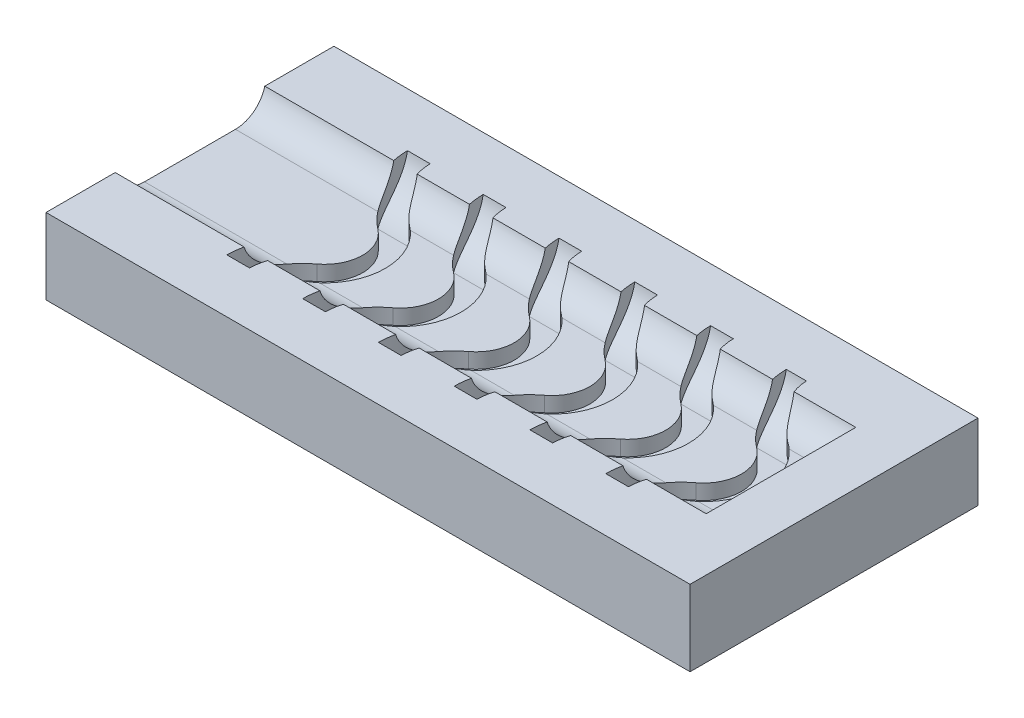
from build123d import *

# Parameters (mm, degrees)
SKETCH1_W            = 56
SKETCH1_H            = 24
BOSS_EXTRUDE1_DEPTH  = 10
SKETCH2_W            = 70
SKETCH2_H            = 38
BOSS_EXTRUDE2_DEPTH  = 7
CUT_EXTRUDE8_DEPTH   = 2
CUT_EXTRUDE10_DEPTH  = 2
CUT_EXTRUDE11_DEPTH  = 2
CUT_EXTRUDE12_DEPTH  = 2
CUT_EXTRUDE13_DEPTH  = 2
CUT_EXTRUDE14_DEPTH  = 2
SKETCH9_W            = 2.87264454
SKETCH9_H            = 24
CUT_EXTRUDE15_DEPTH  = 5
SKETCH10_W           = 24
SKETCH10_H           = 5
CUT_EXTRUDE16_DEPTH  = 18
BOSS_EXTRUDE3_START  = 3
BOSS_EXTRUDE3_DEPTH  = 3
BOSS_EXTRUDE4_DEPTH  = 149
CUT_EXTRUDE17_REACH  = 156.199
SKETCH14_R           = 4
SKETCH15_W           = 38
SKETCH15_H           = 5.821798295
CUT_EXTRUDE18_DEPTH  = 103
SKETCH16_W           = 38
SKETCH16_H           = 10
BOSS_EXTRUDE5_DEPTH  = 7
SKETCH17_W           = 5.389872087
SKETCH17_H           = 2
CUT_EXTRUDE19_DEPTH  = 12
CUT_EXTRUDE20_DEPTH  = 2
BOSS_EXTRUDE6_DEPTH  = 15
BOSS_EXTRUDE8_START  = -2
SKETCH22_W           = 25.766665867
SKETCH22_H           = 23.832159567
BOSS_EXTRUDE8_DEPTH  = 5
CUT_EXTRUDE21_DEPTH  = 5
BOSS_EXTRUDE9_START  = 3
BOSS_EXTRUDE9_DEPTH  = 3
BOSS_EXTRUDE10_DEPTH = 5
CUT_EXTRUDE22_DEPTH  = 5
CUT_EXTRUDE23_START  = -49
CUT_EXTRUDE23_DEPTH  = 49
BOSS_EXTRUDE11_START = -120
BOSS_EXTRUDE11_DEPTH = 120
CUT_EXTRUDE25_START  = -43
CUT_EXTRUDE25_DEPTH  = 43
CUT_EXTRUDE27_START  = -15
CUT_EXTRUDE27_DEPTH  = 15
CUT_EXTRUDE28_DEPTH  = 20


with BuildPart() as part:
    # Sketch1 → Boss-Extrude1 (new body)
    with BuildSketch(Plane(origin=(0, 0, 0), x_dir=(1, 0, 0), z_dir=(0, 1, 0))):
        Polygon((-71.036942105, -38.149752846), (-8.036942105, -38.149752846), (-1.036942105, -38.149752846), (-1.036942105, -0.149752846), (-71.036942105, -0.149752846), align=None)
        with Locations((-36.036942105, -19.149752846)):
            Rectangle(SKETCH1_W, SKETCH1_H, mode=Mode.SUBTRACT)
    extrude(amount=BOSS_EXTRUDE1_DEPTH)

    # Sketch2 → Boss-Extrude2 (add)
    with BuildSketch(Plane.XZ):
        with Locations((-36.036942105, 19.149752846)):
            Rectangle(SKETCH2_W, SKETCH2_H)
    extrude(amount=-BOSS_EXTRUDE2_DEPTH)

    # Sketch3 → Cut-Extrude8 (cut)
    with BuildSketch(Plane(origin=(0, 7, 0), x_dir=(1, 0, 0), z_dir=(0, 1, 0))):
        with BuildLine():
            Line((-19.24851185, -31.149752846), (-16.24851185, -31.149752846))
            ThreePointArc((-16.24851185, -31.149752846), (-15.509502185, -28.019257672), (-13.448511841, -25.549752839))
            ThreePointArc((-13.448511841, -25.549752839), (-10.249398009, -19.030682482), (-13.641129982, -12.609719793))
            ThreePointArc((-13.641129982, -12.609719793), (-15.761818316, -10.226514402), (-16.604744928, -7.149752846))
            Line((-16.604744928, -7.149752846), (-19.24851185, -7.149752846))
            ThreePointArc((-19.24851185, -7.149752846), (-18.192783772, -11.621888777), (-15.248511893, -15.149752813))
            ThreePointArc((-15.248511893, -15.149752813), (-13.24851185, -19.14975286), (-15.248511915, -23.149752894))
            ThreePointArc((-15.248511915, -23.149752894), (-18.192783778, -26.677616927), (-19.24851185, -31.149752846))
        make_face()
    extrude(amount=-CUT_EXTRUDE8_DEPTH, mode=Mode.SUBTRACT)

    # Sketch4 → Cut-Extrude10 (cut)
    with BuildSketch(Plane(origin=(0, 7, 0), x_dir=(1, 0, 0), z_dir=(0, 1, 0))):
        with BuildLine():
            ThreePointArc((-25.248511794, -15.149752887), (-23.24851185, -19.149752907), (-25.248511893, -23.149752878))
            ThreePointArc((-25.248511893, -23.149752878), (-28.192783772, -26.677616914), (-29.24851185, -31.149752846))
            Line((-29.24851185, -31.149752846), (-26.24851185, -31.149752846))
            ThreePointArc((-26.24851185, -31.149752846), (-25.509502185, -28.019257672), (-23.448511841, -25.549752839))
            ThreePointArc((-23.448511841, -25.549752839), (-20.24851185, -19.149752846), (-23.448511841, -12.749752852))
            ThreePointArc((-23.448511841, -12.749752852), (-25.509502185, -10.280248019), (-26.24851185, -7.149752846))
            Line((-26.24851185, -7.149752846), (-29.24851185, -7.149752846))
            ThreePointArc((-29.24851185, -7.149752846), (-28.192783745, -11.621888832), (-25.248511794, -15.149752887))
        make_face()
    extrude(amount=-CUT_EXTRUDE10_DEPTH, mode=Mode.SUBTRACT)

    # Sketch5 → Cut-Extrude11 (cut)
    with BuildSketch(Plane(origin=(0, 7, 0), x_dir=(1, 0, 0), z_dir=(0, 1, 0))):
        with BuildLine():
            ThreePointArc((-35.248511724, -15.14975294), (-33.24851185, -19.149752846), (-35.248511724, -23.149752751))
            ThreePointArc((-35.248511724, -23.149752751), (-38.192783725, -26.67761682), (-39.24851185, -31.149752846))
            Line((-39.24851185, -31.149752846), (-36.24851185, -31.149752846))
            ThreePointArc((-36.24851185, -31.149752846), (-35.509502185, -28.019257672), (-33.448511841, -25.549752839))
            ThreePointArc((-33.448511841, -25.549752839), (-30.24851185, -19.149752771), (-33.44851196, -12.749752763))
            ThreePointArc((-33.44851196, -12.749752763), (-35.509502218, -10.280247952), (-36.24851185, -7.149752846))
            Line((-36.24851185, -7.149752846), (-39.24851185, -7.149752846))
            ThreePointArc((-39.24851185, -7.149752846), (-38.192783725, -11.621888871), (-35.248511724, -15.14975294))
        make_face()
    extrude(amount=-CUT_EXTRUDE11_DEPTH, mode=Mode.SUBTRACT)

    # Sketch6 → Cut-Extrude12 (cut)
    with BuildSketch(Plane(origin=(0, 7, 0), x_dir=(1, 0, 0), z_dir=(0, 1, 0))):
        with BuildLine():
            ThreePointArc((-45.24851166, -15.149752988), (-43.24851185, -19.149752991), (-45.248511893, -23.149752878))
            ThreePointArc((-45.248511893, -23.149752878), (-48.192783772, -26.677616914), (-49.24851185, -31.149752846))
            Line((-49.24851185, -31.149752846), (-46.24851185, -31.149752846))
            ThreePointArc((-46.24851185, -31.149752846), (-45.509502185, -28.019257672), (-43.448511841, -25.549752839))
            ThreePointArc((-43.448511841, -25.549752839), (-40.24851185, -19.149752888), (-43.448511772, -12.749752904))
            ThreePointArc((-43.448511772, -12.749752904), (-45.509502165, -10.280248057), (-46.24851185, -7.149752846))
            Line((-46.24851185, -7.149752846), (-49.24851185, -7.149752846))
            ThreePointArc((-49.24851185, -7.149752846), (-48.192783707, -11.621888907), (-45.24851166, -15.149752988))
        make_face()
    extrude(amount=-CUT_EXTRUDE12_DEPTH, mode=Mode.SUBTRACT)

    # Sketch7 → Cut-Extrude13 (cut)
    with BuildSketch(Plane(origin=(0, 7, 0), x_dir=(1, 0, 0), z_dir=(0, 1, 0))):
        with BuildLine():
            ThreePointArc((-55.248511853, -15.149752843), (-53.24851185, -19.149752765), (-55.248511724, -23.149752751))
            ThreePointArc((-55.248511724, -23.149752751), (-58.192783725, -26.67761682), (-59.24851185, -31.149752846))
            Line((-59.24851185, -31.149752846), (-56.24851185, -31.149752846))
            ThreePointArc((-56.24851185, -31.149752846), (-55.509502185, -28.019257672), (-53.448511841, -25.549752839))
            ThreePointArc((-53.448511841, -25.549752839), (-50.24851185, -19.149752914), (-53.448511731, -12.749752935))
            ThreePointArc((-53.448511731, -12.749752935), (-55.509502154, -10.280248081), (-56.24851185, -7.149752846))
            Line((-56.24851185, -7.149752846), (-59.24851185, -7.149752846))
            ThreePointArc((-59.24851185, -7.149752846), (-58.192783761, -11.621888799), (-55.248511853, -15.149752843))
        make_face()
    extrude(amount=-CUT_EXTRUDE13_DEPTH, mode=Mode.SUBTRACT)

    # Sketch8 → Cut-Extrude14 (cut)
    with BuildSketch(Plane(origin=(0, 7, 0), x_dir=(1, 0, 0), z_dir=(0, 1, 0))):
        with BuildLine():
            ThreePointArc((-64.036942105, -25.951420309), (-61.259500548, -23.042530905), (-60.24851185, -19.149752846))
            Line((-60.24851185, -19.149752846), (-63.24851185, -19.149752846))
            ThreePointArc((-63.24851185, -19.149752846), (-63.449665701, -20.553702858), (-64.036942105, -21.844688889))
            Line((-64.036942105, -21.844688889), (-64.036942105, -25.951420309))
        make_face()
        with BuildLine():
            Line((-63.24851185, -19.149752846), (-60.24851185, -19.149752846))
            ThreePointArc((-60.24851185, -19.149752846), (-61.259500548, -15.256974786), (-64.036942105, -12.348085382))
            Line((-64.036942105, -12.348085382), (-64.036942105, -16.454816802))
            ThreePointArc((-64.036942105, -16.454816802), (-63.449665701, -17.745802833), (-63.24851185, -19.149752846))
        make_face()
        with BuildLine():
            ThreePointArc((-64.036942105, -25.951420309), (-61.259500548, -23.042530905), (-60.24851185, -19.149752846))
            Line((-60.24851185, -19.149752846), (-63.24851185, -19.149752846))
            ThreePointArc((-63.24851185, -19.149752846), (-63.449665701, -20.553702858), (-64.036942105, -21.844688889))
            Line((-64.036942105, -21.844688889), (-64.036942105, -25.951420309))
        make_face()
        with BuildLine():
            Line((-63.24851185, -19.149752846), (-60.24851185, -19.149752846))
            ThreePointArc((-60.24851185, -19.149752846), (-61.259500548, -15.256974786), (-64.036942105, -12.348085382))
            Line((-64.036942105, -12.348085382), (-64.036942105, -16.454816802))
            ThreePointArc((-64.036942105, -16.454816802), (-63.449665701, -17.745802833), (-63.24851185, -19.149752846))
        make_face()
    extrude(amount=-CUT_EXTRUDE14_DEPTH, mode=Mode.SUBTRACT)

    # Sketch9 → Cut-Extrude15 (cut)
    with BuildSketch(Plane(origin=(0, 10, 0), x_dir=(1, 0, 0), z_dir=(0, 1, 0))):
        with Locations((-6.600619835, -19.149752846)):
            Rectangle(SKETCH9_W, SKETCH9_H)
    extrude(amount=-CUT_EXTRUDE15_DEPTH, mode=Mode.SUBTRACT)

    # Sketch10 → Cut-Extrude16 (cut)
    with BuildSketch(Plane.ZY.offset(5.164297565)):
        with Locations((19.149752846, 7.5)):
            Rectangle(SKETCH10_W, SKETCH10_H)
    extrude(amount=-CUT_EXTRUDE16_DEPTH, mode=Mode.SUBTRACT)

    # Sketch12 → Boss-Extrude3 (add)
    with BuildSketch(Plane(origin=(0, 7, 0), x_dir=(1, 0, 0), z_dir=(0, 1, 0)).offset(BOSS_EXTRUDE3_START)):
        with BuildLine():
            Line((-16.24851185, -31.149752846), (-8.036942105, -31.149752846))
            Line((-8.036942105, -31.149752846), (-8.036942105, -7.149752846))
            Line((-8.036942105, -7.149752846), (-16.604744928, -7.149752846))
            ThreePointArc((-16.604744928, -7.149752846), (-15.761818318, -10.226514398), (-13.641129989, -12.609719789))
            ThreePointArc((-13.641129989, -12.609719789), (-10.249398009, -19.030682483), (-13.44851185, -25.549752846))
            ThreePointArc((-13.44851185, -25.549752846), (-15.509502187, -28.019257677), (-16.24851185, -31.149752846))
        make_face()
        with BuildLine():
            Line((-26.24851185, -31.149752846), (-19.24851185, -31.149752846))
            ThreePointArc((-19.24851185, -31.149752846), (-18.19278376, -26.677616891), (-15.24851185, -23.149752846))
            ThreePointArc((-15.24851185, -23.149752846), (-13.24851185, -19.149752846), (-15.24851185, -15.149752846))
            ThreePointArc((-15.24851185, -15.149752846), (-18.19278376, -11.621888801), (-19.24851185, -7.149752846))
            Line((-19.24851185, -7.149752846), (-26.24851185, -7.149752846))
            ThreePointArc((-26.24851185, -7.149752846), (-25.509502187, -10.280248014), (-23.44851185, -12.749752846))
            ThreePointArc((-23.44851185, -12.749752846), (-20.24851185, -19.149752846), (-23.44851185, -25.549752846))
            ThreePointArc((-23.44851185, -25.549752846), (-25.509502187, -28.019257677), (-26.24851185, -31.149752846))
        make_face()
        with BuildLine():
            Line((-36.24851185, -31.149752846), (-29.24851185, -31.149752846))
            ThreePointArc((-29.24851185, -31.149752846), (-28.19278376, -26.677616891), (-25.24851185, -23.149752846))
            ThreePointArc((-25.24851185, -23.149752846), (-23.24851185, -19.149752846), (-25.24851185, -15.149752846))
            ThreePointArc((-25.24851185, -15.149752846), (-28.19278376, -11.621888801), (-29.24851185, -7.149752846))
            Line((-29.24851185, -7.149752846), (-36.24851185, -7.149752846))
            ThreePointArc((-36.24851185, -7.149752846), (-35.509502187, -10.280248014), (-33.44851185, -12.749752846))
            ThreePointArc((-33.44851185, -12.749752846), (-30.24851185, -19.149752846), (-33.44851185, -25.549752846))
            ThreePointArc((-33.44851185, -25.549752846), (-35.509502187, -28.019257677), (-36.24851185, -31.149752846))
        make_face()
        with BuildLine():
            Line((-46.24851185, -31.149752846), (-39.24851185, -31.149752846))
            ThreePointArc((-39.24851185, -31.149752846), (-38.19278376, -26.677616891), (-35.24851185, -23.149752846))
            ThreePointArc((-35.24851185, -23.149752846), (-33.24851185, -19.149752846), (-35.24851185, -15.149752846))
            ThreePointArc((-35.24851185, -15.149752846), (-38.19278376, -11.621888801), (-39.24851185, -7.149752846))
            Line((-39.24851185, -7.149752846), (-46.24851185, -7.149752846))
            ThreePointArc((-46.24851185, -7.149752846), (-45.509502187, -10.280248014), (-43.44851185, -12.749752846))
            ThreePointArc((-43.44851185, -12.749752846), (-40.24851185, -19.149752846), (-43.44851185, -25.549752846))
            ThreePointArc((-43.44851185, -25.549752846), (-45.509502187, -28.019257677), (-46.24851185, -31.149752846))
        make_face()
        with BuildLine():
            Line((-56.24851185, -31.149752846), (-49.24851185, -31.149752846))
            ThreePointArc((-49.24851185, -31.149752846), (-48.19278376, -26.677616891), (-45.24851185, -23.149752846))
            ThreePointArc((-45.24851185, -23.149752846), (-43.24851185, -19.149752846), (-45.24851185, -15.149752846))
            ThreePointArc((-45.24851185, -15.149752846), (-48.19278376, -11.621888801), (-49.24851185, -7.149752846))
            Line((-49.24851185, -7.149752846), (-56.24851185, -7.149752846))
            ThreePointArc((-56.24851185, -7.149752846), (-55.509502187, -10.280248014), (-53.44851185, -12.749752846))
            ThreePointArc((-53.44851185, -12.749752846), (-50.24851185, -19.149752846), (-53.44851185, -25.549752846))
            ThreePointArc((-53.44851185, -25.549752846), (-55.509502187, -28.019257677), (-56.24851185, -31.149752846))
        make_face()
        with BuildLine():
            Line((-64.036942105, -7.149752846), (-64.036942105, -12.348085382))
            ThreePointArc((-64.036942105, -12.348085382), (-60.24851185, -19.149752846), (-64.036942105, -25.951420309))
            Line((-64.036942105, -25.951420309), (-64.036942105, -31.149752846))
            Line((-64.036942105, -31.149752846), (-59.24851185, -31.149752846))
            ThreePointArc((-59.24851185, -31.149752846), (-58.19278376, -26.677616891), (-55.24851185, -23.149752846))
            ThreePointArc((-55.24851185, -23.149752846), (-53.24851185, -19.149752846), (-55.24851185, -15.149752846))
            ThreePointArc((-55.24851185, -15.149752846), (-58.19278376, -11.621888801), (-59.24851185, -7.149752846))
            Line((-59.24851185, -7.149752846), (-64.036942105, -7.149752846))
        make_face()
        with BuildLine():
            Line((-64.036942105, -16.454816802), (-64.036942105, -21.844688889))
            ThreePointArc((-64.036942105, -21.844688889), (-63.24851185, -19.149752846), (-64.036942105, -16.454816802))
        make_face()
    extrude(amount=-BOSS_EXTRUDE3_DEPTH)

    # Sketch13 → Boss-Extrude4 (add)
    with BuildSketch(Plane(origin=(-1.036942105, 0, 0), x_dir=(0, 0, -1), z_dir=(1, 0, 0))):
        with BuildLine():
            Line((-31.149752846, 10), (-31.149752846, 5))
            Line((-31.149752846, 5), (-25.149752846, 5))
            ThreePointArc((-25.149752846, 5), (-29.392393533, 6.757359313), (-31.149752846, 11))
            Line((-31.149752846, 11), (-31.149752846, 10))
        make_face()
        with BuildLine():
            ThreePointArc((-7.149752846, 11), (-8.907112158, 6.757359313), (-13.149752846, 5))
            Line((-13.149752846, 5), (-7.149752846, 5))
            Line((-7.149752846, 5), (-7.149752846, 10))
            Line((-7.149752846, 10), (-7.149752846, 11))
        make_face()
    extrude(amount=-BOSS_EXTRUDE4_DEPTH)

    # Cut-Extrude17: up to this face of the body (flat: up to its plane)
    cut_extrude17_end = Plane(part.part.faces().sort_by_distance((-64.036942105, 7.501737064, 23.896758638))[0])
    # Sketch14 → Cut-Extrude17 (cut, up to the picked face)
    with BuildSketch(Plane(origin=(-1.036942105, 0, 0), x_dir=(0, 0, -1), z_dir=(1, 0, 0)), mode=Mode.PRIVATE) as cut_extrude17_sk1:
        with Locations((-25.149752846, 11)):
            Circle(SKETCH14_R)
    cut_extrude17_tool1 = split(extrude(cut_extrude17_sk1.sketch, amount=-CUT_EXTRUDE17_REACH, mode=Mode.PRIVATE), bisect_by=cut_extrude17_end, keep=Keep.BOTH, mode=Mode.PRIVATE)
    # Sketch14 → Cut-Extrude17 (cut, up to the picked face)
    with BuildSketch(Plane(origin=(-1.036942105, 0, 0), x_dir=(0, 0, -1), z_dir=(1, 0, 0)), mode=Mode.PRIVATE) as cut_extrude17_sk2:
        with BuildLine():
            ThreePointArc((-13.149752846, 15), (-17.149752846, 11), (-13.149752846, 7))
            Line((-13.149752846, 7), (-13.149752846, 15))
        make_face()
    cut_extrude17_tool2 = split(extrude(cut_extrude17_sk2.sketch, amount=-CUT_EXTRUDE17_REACH, mode=Mode.PRIVATE), bisect_by=cut_extrude17_end, keep=Keep.BOTH, mode=Mode.PRIVATE)
    # Sketch14 → Cut-Extrude17 (cut, up to the picked face)
    with BuildSketch(Plane(origin=(-1.036942105, 0, 0), x_dir=(0, 0, -1), z_dir=(1, 0, 0)), mode=Mode.PRIVATE) as cut_extrude17_sk3:
        with BuildLine():
            Line((-13.149752846, 15), (-13.149752846, 7))
            ThreePointArc((-13.149752846, 7), (-10.321325721, 8.171572875), (-9.149752846, 11))
            ThreePointArc((-9.149752846, 11), (-10.321325721, 13.828427125), (-13.149752846, 15))
        make_face()
    cut_extrude17_tool3 = split(extrude(cut_extrude17_sk3.sketch, amount=-CUT_EXTRUDE17_REACH, mode=Mode.PRIVATE), bisect_by=cut_extrude17_end, keep=Keep.BOTH, mode=Mode.PRIVATE)
    # Sketch14 → Cut-Extrude17 (cut, up to the picked face)
    with BuildSketch(Plane(origin=(-1.036942105, 0, 0), x_dir=(0, 0, -1), z_dir=(1, 0, 0)), mode=Mode.PRIVATE) as cut_extrude17_sk4:
        with BuildLine():
            ThreePointArc((-13.149752846, 15), (-17.149752846, 11), (-13.149752846, 7))
            Line((-13.149752846, 7), (-13.149752846, 15))
        make_face()
    cut_extrude17_tool4 = split(extrude(cut_extrude17_sk4.sketch, amount=-CUT_EXTRUDE17_REACH, mode=Mode.PRIVATE), bisect_by=cut_extrude17_end, keep=Keep.BOTH, mode=Mode.PRIVATE)
    # Sketch14 → Cut-Extrude17 (cut, up to the picked face)
    with BuildSketch(Plane(origin=(-1.036942105, 0, 0), x_dir=(0, 0, -1), z_dir=(1, 0, 0)), mode=Mode.PRIVATE) as cut_extrude17_sk5:
        with BuildLine():
            Line((-13.149752846, 15), (-13.149752846, 7))
            ThreePointArc((-13.149752846, 7), (-10.321325721, 8.171572875), (-9.149752846, 11))
            ThreePointArc((-9.149752846, 11), (-10.321325721, 13.828427125), (-13.149752846, 15))
        make_face()
    cut_extrude17_tool5 = split(extrude(cut_extrude17_sk5.sketch, amount=-CUT_EXTRUDE17_REACH, mode=Mode.PRIVATE), bisect_by=cut_extrude17_end, keep=Keep.BOTH, mode=Mode.PRIVATE)
    # Sketch14 → Cut-Extrude17 (cut, up to the picked face)
    with BuildSketch(Plane(origin=(-1.036942105, 0, 0), x_dir=(0, 0, -1), z_dir=(1, 0, 0)), mode=Mode.PRIVATE) as cut_extrude17_sk6:
        with BuildLine():
            ThreePointArc((-21.149752846, 11), (-22.321325721, 8.171572875), (-25.149752846, 7))
            Line((-25.149752846, 7), (-13.149752846, 7))
            ThreePointArc((-13.149752846, 7), (-17.149752846, 11), (-13.149752846, 15))
            Line((-13.149752846, 15), (-25.149752846, 15))
            ThreePointArc((-25.149752846, 15), (-22.321325721, 13.828427125), (-21.149752846, 11))
        make_face()
    cut_extrude17_tool6 = split(extrude(cut_extrude17_sk6.sketch, amount=-CUT_EXTRUDE17_REACH, mode=Mode.PRIVATE), bisect_by=cut_extrude17_end, keep=Keep.BOTH, mode=Mode.PRIVATE)
    add(cut_extrude17_tool1.solids().sort_by(Axis((-1.036942, 11, 25.149753), (-1, 0, 0)))[0], mode=Mode.SUBTRACT)
    add(cut_extrude17_tool2.solids().sort_by(Axis((-1.036942, 11, 14.847406), (-1, 0, 0)))[0], mode=Mode.SUBTRACT)
    add(cut_extrude17_tool3.solids().sort_by(Axis((-1.036942, 11, 11.4521), (-1, 0, 0)))[0], mode=Mode.SUBTRACT)
    add(cut_extrude17_tool4.solids().sort_by(Axis((-1.036942, 11, 14.847406), (-1, 0, 0)))[0], mode=Mode.SUBTRACT)
    add(cut_extrude17_tool5.solids().sort_by(Axis((-1.036942, 11, 11.4521), (-1, 0, 0)))[0], mode=Mode.SUBTRACT)
    add(cut_extrude17_tool6.solids().sort_by(Axis((-1.036942, 11, 19.149753), (-1, 0, 0)))[0], mode=Mode.SUBTRACT)

    # Sketch15 → Cut-Extrude18 (cut)
    with BuildSketch(Plane(origin=(-1.036942105, 0, 0), x_dir=(0, 0, -1), z_dir=(1, 0, 0))):
        with Locations((-19.149752846, 12.910899148)):
            Rectangle(SKETCH15_W, SKETCH15_H)
    extrude(amount=-CUT_EXTRUDE18_DEPTH, mode=Mode.SUBTRACT)

    # Sketch16 → Boss-Extrude5 (add)
    with BuildSketch(Plane(origin=(-1.036942105, 0, 0), x_dir=(0, 0, -1), z_dir=(1, 0, 0))):
        with Locations((-19.149752846, 5)):
            Rectangle(SKETCH16_W, SKETCH16_H)
    extrude(amount=-BOSS_EXTRUDE5_DEPTH)

    # Sketch17 → Cut-Extrude19 (cut)
    with BuildSketch(Plane(origin=(-64.036942105, 0, 0), x_dir=(0, 0, -1), z_dir=(1, 0, 0))):
        with BuildLine():
            ThreePointArc((-13.149752846, 5), (-12.748017595, 5.013464375), (-12.348085382, 5.053797071))
            Line((-12.348085382, 5.053797071), (-12.348085382, 7.081157151))
            ThreePointArc((-12.348085382, 7.081157151), (-10.3942128, 8.10051745), (-9.276769499, 10))
            Line((-9.276769499, 10), (-29.022736192, 10))
            ThreePointArc((-29.022736192, 10), (-27.905292891, 8.10051745), (-25.951420309, 7.081157151))
            Line((-25.951420309, 7.081157151), (-25.951420309, 5.053797071))
            ThreePointArc((-25.951420309, 5.053797071), (-25.551488096, 5.013464375), (-25.149752846, 5))
            Line((-25.149752846, 5), (-21.844688889, 5))
            Line((-21.844688889, 5), (-21.844688889, 7))
            Line((-21.844688889, 7), (-16.454816802, 7))
            Line((-16.454816802, 7), (-16.454816802, 5))
            Line((-16.454816802, 5), (-13.149752846, 5))
        make_face()
        with Locations((-19.149752846, 6)):
            Rectangle(SKETCH17_W, SKETCH17_H)
    extrude(amount=-CUT_EXTRUDE19_DEPTH, mode=Mode.SUBTRACT)

    # Sketch18 → Cut-Extrude20 (cut)
    with BuildSketch(Plane(origin=(0, 7, 0), x_dir=(1, 0, 0), z_dir=(0, 1, 0))):
        with BuildLine():
            Line((-64.036942105, -16.454816802), (-64.036942105, -21.844688889))
            ThreePointArc((-64.036942105, -21.844688889), (-63.24851185, -19.149752846), (-64.036942105, -16.454816802))
        make_face()
    extrude(amount=-CUT_EXTRUDE20_DEPTH, mode=Mode.SUBTRACT)

    # Sketch19 → Boss-Extrude6 (add)
    with BuildSketch(Plane.ZY.offset(71.036942105)):
        Polygon((25.149752846, 5), (13.149752846, 5), (7.149752846, 5), (7.149752846, 10), (0.149752846, 10), (0.149752846, 0), (38.149752846, 0), (38.149752846, 10), (31.149752846, 10), (31.149752846, 5), align=None)
    extrude(amount=BOSS_EXTRUDE6_DEPTH)

    # Sketch22 → Boss-Extrude8 (add)
    with BuildSketch(Plane(origin=(0, 7, 0), x_dir=(1, 0, 0), z_dir=(0, 1, 0)).offset(BOSS_EXTRUDE8_START)):
        with Locations((-73.153609172, -19.149752846)):
            Rectangle(SKETCH22_W, SKETCH22_H)
    extrude(amount=BOSS_EXTRUDE8_DEPTH)

    # Sketch23 → Cut-Extrude21 (cut)
    with BuildSketch(Plane(origin=(0, 10, 0), x_dir=(1, 0, 0), z_dir=(0, 1, 0))):
        with BuildLine():
            ThreePointArc((-65.234966184, -15.159948024), (-63.24851185, -19.149752851), (-65.234966193, -23.139557675))
            ThreePointArc((-65.234966193, -23.139557675), (-68.140167328, -26.638656659), (-69.181320664, -31.065832629))
            Line((-69.181320664, -31.065832629), (-66.181320664, -31.065832629))
            ThreePointArc((-66.181320664, -31.065832629), (-65.45461505, -27.975746395), (-63.426838835, -25.533440599))
            ThreePointArc((-63.426838835, -25.533440599), (-60.24851185, -19.149752846), (-63.426838835, -12.766065092))
            ThreePointArc((-63.426838835, -12.766065092), (-65.45461505, -10.323759296), (-66.181320664, -7.233673062))
            Line((-66.181320664, -7.233673062), (-69.181320664, -7.233673062))
            ThreePointArc((-69.181320664, -7.233673062), (-68.140167325, -11.660849037), (-65.234966184, -15.159948024))
        make_face()
    extrude(amount=-CUT_EXTRUDE21_DEPTH, mode=Mode.SUBTRACT)

    # Sketch24 → Boss-Extrude9 (add)
    with BuildSketch(Plane(origin=(0, 7, 0), x_dir=(1, 0, 0), z_dir=(0, 1, 0)).offset(BOSS_EXTRUDE9_START)):
        with BuildLine():
            ThreePointArc((-60.270276238, -18.560044), (-60.24851185, -19.149752846), (-60.270276238, -19.739461691))
            Line((-60.270276238, -19.739461691), (-60.270276238, -25.149752846))
            Line((-60.270276238, -25.149752846), (-57.24851185, -25.149752846))
            ThreePointArc((-57.24851185, -25.149752846), (-56.319579662, -24.078685034), (-55.24851185, -23.149752846))
            ThreePointArc((-55.24851185, -23.149752846), (-53.24851185, -19.149752846), (-55.24851185, -15.149752846))
            ThreePointArc((-55.24851185, -15.149752846), (-56.319579662, -14.220820657), (-57.24851185, -13.149752846))
            Line((-57.24851185, -13.149752846), (-60.270276238, -13.149752846))
            Line((-60.270276238, -13.149752846), (-60.270276238, -18.560044))
        make_face()
        with BuildLine():
            ThreePointArc((-59.019683743, -9.276769499), (-58.342665885, -11.308642408), (-57.24851185, -13.149752846))
            Line((-57.24851185, -13.149752846), (-60.270276238, -13.149752846))
            Line((-60.270276238, -13.149752846), (-60.270276238, -9.276769499))
            Line((-60.270276238, -9.276769499), (-59.019683743, -9.276769499))
        make_face()
        with BuildLine():
            ThreePointArc((-57.24851185, -25.149752846), (-58.342665885, -26.990863283), (-59.019683743, -29.022736192))
            Line((-59.019683743, -29.022736192), (-60.270276238, -29.022736192))
            Line((-60.270276238, -29.022736192), (-60.270276238, -25.149752846))
            Line((-60.270276238, -25.149752846), (-57.24851185, -25.149752846))
        make_face()
    extrude(amount=-BOSS_EXTRUDE9_DEPTH)

    # Sketch25 → Boss-Extrude10 (add)
    with BuildSketch(Plane(origin=(0, 10, 0), x_dir=(1, 0, 0), z_dir=(0, 1, 0))):
        Polygon((-72.481833593, -7.233673062), (-61.581700406, -7.233673062), (-59.566549733, -14.340870557), (-58.176258746, -19.244262025), (-61.581700406, -28.355327512), (-64.4212309, -33.393204195), (-72.481833593, -33.393204195), align=None)
    extrude(amount=-BOSS_EXTRUDE10_DEPTH)

    # Sketch26 → Cut-Extrude22 (cut)
    with BuildSketch(Plane(origin=(0, 10, 0), x_dir=(1, 0, 0), z_dir=(0, 1, 0))):
        with BuildLine():
            ThreePointArc((-65.248511779, -15.149752899), (-63.24851185, -19.149752917), (-65.248511893, -23.149752878))
            ThreePointArc((-65.248511893, -23.149752878), (-68.173939736, -26.640125692), (-69.248159714, -31.065832629))
            Line((-69.248159714, -31.065832629), (-66.248008789, -31.065832629))
            ThreePointArc((-66.248008789, -31.065832629), (-65.490624228, -27.98178298), (-63.448511841, -25.549752839))
            ThreePointArc((-63.448511841, -25.549752839), (-60.24851185, -19.149752846), (-63.448511841, -12.749752852))
            ThreePointArc((-63.448511841, -12.749752852), (-65.490624228, -10.317722711), (-66.248008789, -7.233673062))
            Line((-66.248008789, -7.233673062), (-69.248159714, -7.233673062))
            ThreePointArc((-69.248159714, -7.233673062), (-68.173939704, -11.659380062), (-65.248511779, -15.149752899))
        make_face()
    extrude(amount=-CUT_EXTRUDE22_DEPTH, mode=Mode.SUBTRACT)

    # Sketch27 → Cut-Extrude23 (cut)
    with BuildSketch(Plane.ZY.offset(150.036942105).offset(CUT_EXTRUDE23_START)):
        with BuildLine():
            Line((7.149752846, 11), (7.149752846, 5))
            Line((7.149752846, 5), (13.149752846, 5))
            ThreePointArc((13.149752846, 5), (8.907112158, 6.757359313), (7.149752846, 11))
        make_face()
        with BuildLine():
            Line((25.149752846, 5), (31.149752846, 5))
            Line((31.149752846, 5), (31.149752846, 11))
            ThreePointArc((31.149752846, 11), (29.392393533, 6.757359313), (25.149752846, 5))
        make_face()
    extrude(amount=CUT_EXTRUDE23_DEPTH, mode=Mode.SUBTRACT)

    # Sketch28 → Boss-Extrude11 (add)
    with BuildSketch(Plane.ZY.offset(101.036942105).offset(BOSS_EXTRUDE11_START)):
        with BuildLine():
            Line((25.149752846, 5), (31.149752846, 5))
            Line((31.149752846, 5), (31.149752846, 10))
            Line((31.149752846, 10), (31.065832629, 10))
            ThreePointArc((31.065832629, 10), (29.022736192, 6.417424305), (25.149752846, 5))
        make_face()
        with BuildLine():
            Line((7.149752846, 10), (7.149752846, 5))
            Line((7.149752846, 5), (13.149752846, 5))
            ThreePointArc((13.149752846, 5), (9.276769499, 6.417424305), (7.233673062, 10))
            Line((7.233673062, 10), (7.149752846, 10))
        make_face()
    extrude(amount=BOSS_EXTRUDE11_DEPTH)

    # Sketch29 → Cut-Extrude25 (cut)
    with BuildSketch(Plane.ZY.offset(86.036942105).offset(CUT_EXTRUDE25_START)):
        with BuildLine():
            ThreePointArc((9.276769499, 10), (10.700263103, 7.83772234), (13.149752846, 7))
            ThreePointArc((13.149752846, 7), (15.599242588, 7.83772234), (17.022736192, 10))
            Line((17.022736192, 10), (9.276769499, 10))
        make_face()
        with BuildLine():
            ThreePointArc((13.149752846, 15), (9.987475185, 13.449489743), (9.276769499, 10))
            Line((9.276769499, 10), (17.022736192, 10))
            ThreePointArc((17.022736192, 10), (17.117871631, 10.49598283), (17.149752846, 11))
            ThreePointArc((17.149752846, 11), (15.97817997, 13.828427125), (13.149752846, 15))
        make_face()
        with BuildLine():
            ThreePointArc((21.276769499, 10), (22.700263103, 7.83772234), (25.149752846, 7))
            ThreePointArc((25.149752846, 7), (27.599242588, 7.83772234), (29.022736192, 10))
            Line((29.022736192, 10), (21.276769499, 10))
        make_face()
        with BuildLine():
            ThreePointArc((25.149752846, 15), (21.987475185, 13.449489743), (21.276769499, 10))
            Line((21.276769499, 10), (29.022736192, 10))
            ThreePointArc((29.022736192, 10), (29.117871631, 10.49598283), (29.149752846, 11))
            ThreePointArc((29.149752846, 11), (27.97817997, 13.828427125), (25.149752846, 15))
        make_face()
        with BuildLine():
            ThreePointArc((21.276769499, 10), (22.700263103, 7.83772234), (25.149752846, 7))
            ThreePointArc((25.149752846, 7), (27.599242588, 7.83772234), (29.022736192, 10))
            Line((29.022736192, 10), (21.276769499, 10))
        make_face()
        with BuildLine():
            ThreePointArc((25.149752846, 15), (21.987475185, 13.449489743), (21.276769499, 10))
            Line((21.276769499, 10), (29.022736192, 10))
            ThreePointArc((29.022736192, 10), (29.117871631, 10.49598283), (29.149752846, 11))
            ThreePointArc((29.149752846, 11), (27.97817997, 13.828427125), (25.149752846, 15))
        make_face()
        with BuildLine():
            ThreePointArc((9.276769499, 10), (10.700263103, 7.83772234), (13.149752846, 7))
            ThreePointArc((13.149752846, 7), (15.599242588, 7.83772234), (17.022736192, 10))
            Line((17.022736192, 10), (9.276769499, 10))
        make_face()
        with BuildLine():
            ThreePointArc((13.149752846, 15), (9.987475185, 13.449489743), (9.276769499, 10))
            Line((9.276769499, 10), (17.022736192, 10))
            ThreePointArc((17.022736192, 10), (17.117871631, 10.49598283), (17.149752846, 11))
            ThreePointArc((17.149752846, 11), (15.97817997, 13.828427125), (13.149752846, 15))
        make_face()
        with BuildLine():
            ThreePointArc((17.022736192, 10), (15.599242588, 7.83772234), (13.149752846, 7))
            Line((13.149752846, 7), (25.149752846, 7))
            ThreePointArc((25.149752846, 7), (22.700263103, 7.83772234), (21.276769499, 10))
            Line((21.276769499, 10), (17.022736192, 10))
        make_face()
        with BuildLine():
            ThreePointArc((17.149752846, 11), (17.117871631, 10.49598283), (17.022736192, 10))
            Line((17.022736192, 10), (21.276769499, 10))
            ThreePointArc((21.276769499, 10), (21.987475185, 13.449489743), (25.149752846, 15))
            Line((25.149752846, 15), (13.149752846, 15))
            ThreePointArc((13.149752846, 15), (15.97817997, 13.828427125), (17.149752846, 11))
        make_face()
    extrude(amount=CUT_EXTRUDE25_DEPTH, mode=Mode.SUBTRACT)

    # Sketch31 → Cut-Extrude27 (cut)
    with BuildSketch(Plane.ZY.offset(101.036942105).offset(CUT_EXTRUDE27_START)):
        with BuildLine():
            Line((7.149752846, 10), (7.149752846, 5))
            Line((7.149752846, 5), (13.149752846, 5))
            ThreePointArc((13.149752846, 5), (9.276769499, 6.417424305), (7.233673062, 10))
            Line((7.233673062, 10), (7.149752846, 10))
        make_face()
        with BuildLine():
            Line((25.149752846, 5), (31.149752846, 5))
            Line((31.149752846, 5), (31.149752846, 10))
            Line((31.149752846, 10), (31.065832629, 10))
            ThreePointArc((31.065832629, 10), (29.022736192, 6.417424305), (25.149752846, 5))
        make_face()
    extrude(amount=CUT_EXTRUDE27_DEPTH, mode=Mode.SUBTRACT)

    # Sketch32 → Cut-Extrude28 (cut)
    with BuildSketch(Plane(origin=(18.963057895, 0, 0), x_dir=(0, 0, -1), z_dir=(1, 0, 0))):
        with BuildLine():
            Line((-7.149752846, 10), (-7.233673062, 10))
            ThreePointArc((-7.233673062, 10), (-9.276769499, 6.417424305), (-13.149752846, 5))
            Line((-13.149752846, 5), (-7.149752846, 5))
            Line((-7.149752846, 5), (-7.149752846, 10))
        make_face()
        with BuildLine():
            Line((-31.065832629, 10), (-31.149752846, 10))
            Line((-31.149752846, 10), (-31.149752846, 5))
            Line((-31.149752846, 5), (-25.149752846, 5))
            ThreePointArc((-25.149752846, 5), (-29.022736192, 6.417424305), (-31.065832629, 10))
        make_face()
    extrude(amount=-CUT_EXTRUDE28_DEPTH, mode=Mode.SUBTRACT)


solid = part.part
